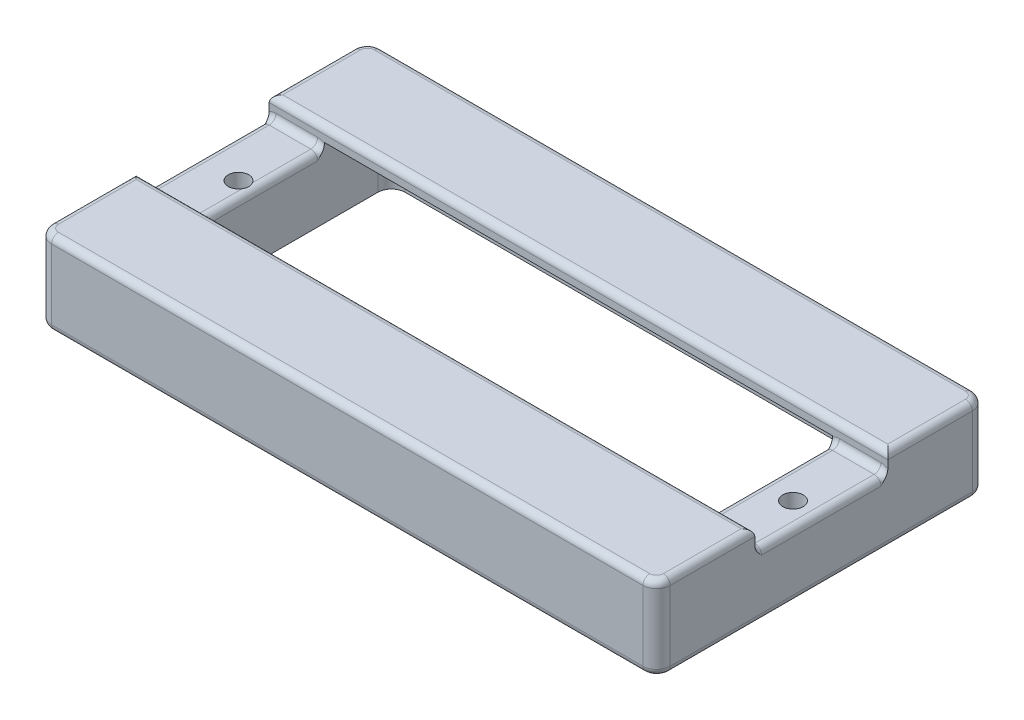
from build123d import *

# Parameters (mm, degrees)
SKETCH1_W           = 90.7
SKETCH1_H           = 48.3
SKETCH1_W_2         = 74.5
SKETCH1_H_2         = 38.17
BOSS_EXTRUDE1_DEPTH = 12.25
SKETCH2_W           = 90.7
SKETCH2_H           = 14.4
BOSS_EXTRUDE2_DEPTH = 2
SKETCH3_W           = 8.1
SKETCH3_H           = 19.5
CUT_EXTRUDE1_DEPTH  = 2.85
SKETCH4_R           = 1.5
CUT_EXTRUDE2_DEPTH  = 6.5
SKETCH5_R           = 1.5
CUT_EXTRUDE3_DEPTH  = 54.047724032
FILLET7_R           = 1
FILLET4_R           = 2
FILLET5_R           = 1
FILLET8_R           = 1


with BuildPart() as part:
    # Sketch1 → Boss-Extrude1 (new body)
    with BuildSketch(Plane(origin=(0, 0, 0), x_dir=(1, 0, 0), z_dir=(0, 1, 0))):
        with Locations((0, -0.495)):
            Rectangle(SKETCH1_W, SKETCH1_H)
        Rectangle(SKETCH1_W_2, SKETCH1_H_2, mode=Mode.SUBTRACT)
    extrude(amount=BOSS_EXTRUDE1_DEPTH)

    # Sketch2 → Boss-Extrude2 (add)
    with BuildSketch(Plane(origin=(0, 12.25, 0), x_dir=(1, 0, 0), z_dir=(0, 1, 0))):
        with Locations((0, 16.455)):
            Rectangle(SKETCH2_W, SKETCH2_H)
        with Locations((0, -17.445)):
            Rectangle(SKETCH2_W, SKETCH2_H)
    extrude(amount=-BOSS_EXTRUDE2_DEPTH)

    # Sketch3 → Cut-Extrude1 (cut)
    with BuildSketch(Plane(origin=(0, 12.25, 0), x_dir=(1, 0, 0), z_dir=(0, 1, 0))):
        with Locations((-41.3, -0.495)):
            Rectangle(SKETCH3_W, SKETCH3_H)
        with Locations((41.3, -0.495)):
            Rectangle(SKETCH3_W, SKETCH3_H)
    extrude(amount=-CUT_EXTRUDE1_DEPTH, mode=Mode.SUBTRACT)

    # Sketch4 → Cut-Extrude2 (cut)
    with BuildSketch(Plane.XZ):
        with Locations(Location((-39.55, 21.045, 0), (0, 0, 270))):
            Circle(SKETCH4_R)
        with Locations(Location((41.75, 21.045, 0), (0, 0, 270))):
            Circle(SKETCH4_R)
        with Locations(Location((41.75, -17.855, 0), (0, 0, 270))):
            Circle(SKETCH4_R)
        with Locations(Location((-39.55, -17.855, 0), (0, 0, 270))):
            Circle(SKETCH4_R)
    extrude(amount=-CUT_EXTRUDE2_DEPTH, mode=Mode.SUBTRACT)

    # Sketch5 → Cut-Extrude3 (cut, through all)
    with BuildSketch(Plane.XZ):
        with Locations(Location((-39.55, 1.045, 0), (0, 0, 270))):
            Circle(SKETCH5_R)
        with Locations(Location((41.75, 1.045, 0), (0, 0, 270))):
            Circle(SKETCH5_R)
    extrude(amount=-CUT_EXTRUDE3_DEPTH, mode=Mode.SUBTRACT)

    # Fillet7
    fillet7_edges = [part.edges().sort_by_distance(p)[0] for p in [
        (45.35, 12.25, 17.445),
        (0, 12.25, -23.655),
        (-45.35, 12.25, -16.455),
        (0, 0, -23.655),
        (0, 12.25, -9.255),
        (45.35, 0, 0.495),
        (0, 0, 24.645),
        (0, 12.25, 10.245),
        (-45.35, 0, 0.495),
        (45.35, 12.25, -16.455),
        (-45.35, 12.25, 17.445),
        (0, 12.25, 24.645),
    ]]
    fillet(fillet7_edges, radius=FILLET7_R)

    # Fillet4
    # the kernel refuses this fillet: 2 mm, written as the material it adds along each edge
    with BuildSketch(Plane(origin=(-37.25, 0, 19.085), x_dir=(0, 0, -1), z_dir=(0, 1, 0)), Plane(origin=(37.25, 0, -19.085), x_dir=(0, 0, 1), z_dir=(0, 1, 0))) as fillet4_piece_1:
        with BuildLine():
            CenterArc((FILLET4_R, -FILLET4_R), FILLET4_R, 90, 90)
            Line((0, -FILLET4_R), (0, 0))
            Line((0, 0), (FILLET4_R, 0))
        make_face()
    extrude(amount=10.25)
    with BuildSketch(Plane(origin=(37.25, 0, 19.085), x_dir=(0, 0, -1), z_dir=(0, 1, 0)), Plane(origin=(-37.25, 0, -19.085), x_dir=(0, 0, 1), z_dir=(0, 1, 0))) as fillet4_piece_2:
        with BuildLine():
            CenterArc((FILLET4_R, FILLET4_R), FILLET4_R, 180, 90)
            Line((0, FILLET4_R), (0, 0))
            Line((0, 0), (FILLET4_R, 0))
        make_face()
    extrude(amount=10.25)
    # the kernel refuses this fillet: 2 mm, written as the material it takes off along each edge
    with BuildSketch(Plane(origin=(-43.35, 12.25, 22.645), x_dir=(-1, 0, 0), z_dir=(0, 0, -1))) as fillet4_2_piece_1:
        with BuildLine():
            CenterArc((1, -1), 1, 0, 90)
            Line((2, -1), (2, 0))
            Line((2, 0), (1, 0))
        make_face()
    revolve(axis=Axis((-43.35, 12.25, 22.645), (0, 1, 0)), revolution_arc=90, mode=Mode.SUBTRACT)
    with BuildSketch(Plane(origin=(43.35, 12.25, 22.645), x_dir=(0, 0, 1), z_dir=(-1, 0, 0))) as fillet4_2_piece_2:
        with BuildLine():
            CenterArc((1, -1), 1, 0, 90)
            Line((2, -1), (2, 0))
            Line((2, 0), (1, 0))
        make_face()
    revolve(axis=Axis((43.35, 12.25, 22.645), (0, 1, 0)), revolution_arc=90, mode=Mode.SUBTRACT)
    with BuildSketch(Plane(origin=(-43.35, 12.25, -21.655), x_dir=(0, 0, -1), z_dir=(1, 0, 0))) as fillet4_2_piece_3:
        with BuildLine():
            CenterArc((1, -1), 1, 0, 90)
            Line((2, -1), (2, 0))
            Line((2, 0), (1, 0))
        make_face()
    revolve(axis=Axis((-43.35, 12.25, -21.655), (0, 1, 0)), revolution_arc=90, mode=Mode.SUBTRACT)
    with BuildSketch(Plane(origin=(43.35, 12.25, -21.655), x_dir=(1, 0, 0), z_dir=(0, 0, 1))) as fillet4_2_piece_4:
        with BuildLine():
            CenterArc((1, -1), 1, 0, 90)
            Line((2, -1), (2, 0))
            Line((2, 0), (1, 0))
        make_face()
    revolve(axis=Axis((43.35, 12.25, -21.655), (0, 1, 0)), revolution_arc=90, mode=Mode.SUBTRACT)
    with BuildSketch(Plane(origin=(-43.35, 0, -21.655), x_dir=(-1, 0, 0), z_dir=(0, 0, 1))) as fillet4_2_piece_5:
        with BuildLine():
            CenterArc((1, -1), 1, 0, 90)
            Line((2, -1), (2, 0))
            Line((2, 0), (1, 0))
        make_face()
    revolve(axis=Axis((-43.35, 0, -21.655), (0, -1, 0)), revolution_arc=90, mode=Mode.SUBTRACT)
    with BuildSketch(Plane(origin=(43.35, 0, -21.655), x_dir=(0, 0, -1), z_dir=(-1, 0, 0))) as fillet4_2_piece_6:
        with BuildLine():
            CenterArc((1, -1), 1, 0, 90)
            Line((2, -1), (2, 0))
            Line((2, 0), (1, 0))
        make_face()
    revolve(axis=Axis((43.35, 0, -21.655), (0, -1, 0)), revolution_arc=90, mode=Mode.SUBTRACT)
    with BuildSketch(Plane(origin=(-43.35, 0, 22.645), x_dir=(0, 0, 1), z_dir=(1, 0, 0))) as fillet4_2_piece_7:
        with BuildLine():
            CenterArc((1, -1), 1, 0, 90)
            Line((2, -1), (2, 0))
            Line((2, 0), (1, 0))
        make_face()
    revolve(axis=Axis((-43.35, 0, 22.645), (0, -1, 0)), revolution_arc=90, mode=Mode.SUBTRACT)
    with BuildSketch(Plane(origin=(43.35, 0, 22.645), x_dir=(1, 0, 0), z_dir=(0, 0, -1))) as fillet4_2_piece_8:
        with BuildLine():
            CenterArc((1, -1), 1, 0, 90)
            Line((2, -1), (2, 0))
            Line((2, 0), (1, 0))
        make_face()
    revolve(axis=Axis((43.35, 0, 22.645), (0, -1, 0)), revolution_arc=90, mode=Mode.SUBTRACT)
    with BuildSketch(Plane(origin=(45.35, 12.25, 24.645), x_dir=(0, 0, -1), z_dir=(0, -1, 0)), Plane(origin=(45.35, 12.25, -23.655), x_dir=(-1, 0, 0), z_dir=(0, -1, 0)), Plane(origin=(-45.35, 0, 24.645), x_dir=(0, 0, -1), z_dir=(0, 1, 0)), Plane(origin=(-45.35, 0, -23.655), x_dir=(1, 0, 0), z_dir=(0, 1, 0))) as fillet4_2_piece_9:
        with BuildLine():
            CenterArc((FILLET4_R, -FILLET4_R), FILLET4_R, 90, 90)
            Line((0, -FILLET4_R), (0, 0))
            Line((0, 0), (FILLET4_R, 0))
        make_face()
    extrude(amount=12.25, mode=Mode.SUBTRACT)

    # Fillet5
    # the kernel refuses this fillet: 1 mm, written as the material it takes off along each edge
    with BuildSketch(Plane(origin=(-45.35, 9.4, -9.255), x_dir=(0, -1, 0), z_dir=(0, 0, 1)), Plane(origin=(-37.25, 9.4, 10.245), x_dir=(0, -1, 0), z_dir=(0, 0, -1)), Plane(origin=(37.25, 9.4, -9.255), x_dir=(0, -1, 0), z_dir=(0, 0, 1))) as fillet5_piece_1:
        with BuildLine():
            CenterArc((FILLET5_R, FILLET5_R), FILLET5_R, 180, 90)
            Line((0, FILLET5_R), (0, 0))
            Line((0, 0), (FILLET5_R, 0))
        make_face()
    extrude(amount=19.5, mode=Mode.SUBTRACT)
    with BuildSketch(Plane(origin=(45.35, 9.4, 10.245), x_dir=(-1, 0, 0), z_dir=(0, 0, -1))) as fillet5_piece_2:
        with BuildLine():
            CenterArc((FILLET5_R, -FILLET5_R), FILLET5_R, 90, 90)
            Line((0, -FILLET5_R), (0, 0))
            Line((0, 0), (FILLET5_R, 0))
        make_face()
    extrude(amount=19.5, mode=Mode.SUBTRACT)

    # Fillet8
    # the kernel refuses this fillet: 1 mm, written as the material it adds along each edge
    with BuildSketch(Plane(origin=(44.35, 9.4, -9.255), x_dir=(0, 1, 0), z_dir=(-1, 0, 0)), Plane(origin=(38.25, 9.4, 10.245), x_dir=(0, 1, 0), z_dir=(1, 0, 0)), Plane(origin=(-44.35, 9.4, 10.245), x_dir=(0, 1, 0), z_dir=(1, 0, 0)), Plane(origin=(-38.25, 9.4, -9.255), x_dir=(0, 1, 0), z_dir=(-1, 0, 0))) as fillet8_piece_1:
        with BuildLine():
            CenterArc((FILLET8_R, -FILLET8_R), FILLET8_R, 90, 90)
            Line((0, -FILLET8_R), (0, 0))
            Line((0, 0), (FILLET8_R, 0))
        make_face()
    extrude(amount=6.1)
    with BuildSketch(Plane(origin=(44.35, 8.4, -9.255), x_dir=(0, 1, 0), z_dir=(-1, 0, 0))) as fillet8_piece_2_section:
        with BuildLine():
            CenterArc((1 + FILLET8_R, -FILLET8_R), FILLET8_R, 90, 90)
            Line((1, -FILLET8_R), (1, 0))
            Line((1, 0), (1 + FILLET8_R, 0))
        make_face()
    fillet8_piece_2 = revolve(axis=Axis((44.35, 8.4, -9.255), (0, 0, -1)), revolution_arc=233.296989237, mode=Mode.PRIVATE)
    fillet8_piece_2 = split(fillet8_piece_2, bisect_by=Plane(origin=(45.35, 9.619775247, -9.087699795), z_dir=(-1, 0, 0)), keep=Keep.TOP, mode=Mode.PRIVATE)
    add(fillet8_piece_2)
    with BuildSketch(Plane(origin=(44.35, 8.4, 10.245), x_dir=(0, 1, 0), z_dir=(-1, 0, 0))) as fillet8_piece_3_section:
        with BuildLine():
            CenterArc((1 + FILLET8_R, FILLET8_R), FILLET8_R, 180, 90)
            Line((1, FILLET8_R), (1, 0))
            Line((1, 0), (1 + FILLET8_R, 0))
        make_face()
    fillet8_piece_3 = revolve(axis=Axis((44.35, 8.4, 10.245), (0, 0, -1)), revolution_arc=233.296989237, mode=Mode.PRIVATE)
    fillet8_piece_3 = split(fillet8_piece_3, bisect_by=Plane(origin=(45.35, 9.619775247, 10.077699795), z_dir=(-1, 0, 0)), keep=Keep.TOP, mode=Mode.PRIVATE)
    add(fillet8_piece_3)
    with BuildSketch(Plane(origin=(38.25, 8.4, 10.245), x_dir=(0, 1, 0), z_dir=(1, 0, 0))) as fillet8_piece_4_section:
        with BuildLine():
            CenterArc((1 + FILLET8_R, -FILLET8_R), FILLET8_R, 90, 90)
            Line((1, -FILLET8_R), (1, 0))
            Line((1, 0), (1 + FILLET8_R, 0))
        make_face()
    fillet8_piece_4 = revolve(axis=Axis((38.25, 8.4, 10.245), (0, 0, 1)), revolution_arc=233.296989237, mode=Mode.PRIVATE)
    fillet8_piece_4 = split(fillet8_piece_4, bisect_by=Plane(origin=(37.25, 9.619775248, 10.077699795), z_dir=(1, 0, 0)), keep=Keep.TOP, mode=Mode.PRIVATE)
    add(fillet8_piece_4)
    with BuildSketch(Plane(origin=(38.25, 8.4, -9.255), x_dir=(0, 1, 0), z_dir=(1, 0, 0))) as fillet8_piece_5_section:
        with BuildLine():
            CenterArc((1 + FILLET8_R, FILLET8_R), FILLET8_R, 180, 90)
            Line((1, FILLET8_R), (1, 0))
            Line((1, 0), (1 + FILLET8_R, 0))
        make_face()
    fillet8_piece_5 = revolve(axis=Axis((38.25, 8.4, -9.255), (0, 0, 1)), revolution_arc=233.296989237, mode=Mode.PRIVATE)
    fillet8_piece_5 = split(fillet8_piece_5, bisect_by=Plane(origin=(37.25, 9.619775248, -9.087699795), z_dir=(1, 0, 0)), keep=Keep.TOP, mode=Mode.PRIVATE)
    add(fillet8_piece_5)
    with BuildSketch(Plane(origin=(-38.25, 8.4, -9.255), x_dir=(0, 1, 0), z_dir=(-1, 0, 0))) as fillet8_piece_6_section:
        with BuildLine():
            CenterArc((1 + FILLET8_R, -FILLET8_R), FILLET8_R, 90, 90)
            Line((1, -FILLET8_R), (1, 0))
            Line((1, 0), (1 + FILLET8_R, 0))
        make_face()
    fillet8_piece_6 = revolve(axis=Axis((-38.25, 8.4, -9.255), (0, 0, -1)), revolution_arc=233.296989237, mode=Mode.PRIVATE)
    fillet8_piece_6 = split(fillet8_piece_6, bisect_by=Plane(origin=(-37.25, 9.619775247, -9.087699795), z_dir=(-1, 0, 0)), keep=Keep.TOP, mode=Mode.PRIVATE)
    add(fillet8_piece_6)
    with BuildSketch(Plane(origin=(-38.25, 8.4, 10.245), x_dir=(0, 1, 0), z_dir=(-1, 0, 0))) as fillet8_piece_7_section:
        with BuildLine():
            CenterArc((1 + FILLET8_R, FILLET8_R), FILLET8_R, 180, 90)
            Line((1, FILLET8_R), (1, 0))
            Line((1, 0), (1 + FILLET8_R, 0))
        make_face()
    fillet8_piece_7 = revolve(axis=Axis((-38.25, 8.4, 10.245), (0, 0, -1)), revolution_arc=233.296989237, mode=Mode.PRIVATE)
    fillet8_piece_7 = split(fillet8_piece_7, bisect_by=Plane(origin=(-37.25, 9.619775247, 10.077699795), z_dir=(-1, 0, 0)), keep=Keep.TOP, mode=Mode.PRIVATE)
    add(fillet8_piece_7)
    with BuildSketch(Plane(origin=(-44.35, 8.4, 10.245), x_dir=(0, 1, 0), z_dir=(1, 0, 0))) as fillet8_piece_8_section:
        with BuildLine():
            CenterArc((1 + FILLET8_R, -FILLET8_R), FILLET8_R, 90, 90)
            Line((1, -FILLET8_R), (1, 0))
            Line((1, 0), (1 + FILLET8_R, 0))
        make_face()
    fillet8_piece_8 = revolve(axis=Axis((-44.35, 8.4, 10.245), (0, 0, 1)), revolution_arc=233.296989237, mode=Mode.PRIVATE)
    fillet8_piece_8 = split(fillet8_piece_8, bisect_by=Plane(origin=(-45.35, 9.619775248, 10.077699795), z_dir=(1, 0, 0)), keep=Keep.TOP, mode=Mode.PRIVATE)
    add(fillet8_piece_8)
    with BuildSketch(Plane(origin=(-44.35, 8.4, -9.255), x_dir=(0, 1, 0), z_dir=(1, 0, 0))) as fillet8_piece_9_section:
        with BuildLine():
            CenterArc((1 + FILLET8_R, FILLET8_R), FILLET8_R, 180, 90)
            Line((1, FILLET8_R), (1, 0))
            Line((1, 0), (1 + FILLET8_R, 0))
        make_face()
    fillet8_piece_9 = revolve(axis=Axis((-44.35, 8.4, -9.255), (0, 0, 1)), revolution_arc=233.296989237, mode=Mode.PRIVATE)
    fillet8_piece_9 = split(fillet8_piece_9, bisect_by=Plane(origin=(-45.35, 9.619775248, -9.087699795), z_dir=(1, 0, 0)), keep=Keep.TOP, mode=Mode.PRIVATE)
    add(fillet8_piece_9)


solid = part.part
